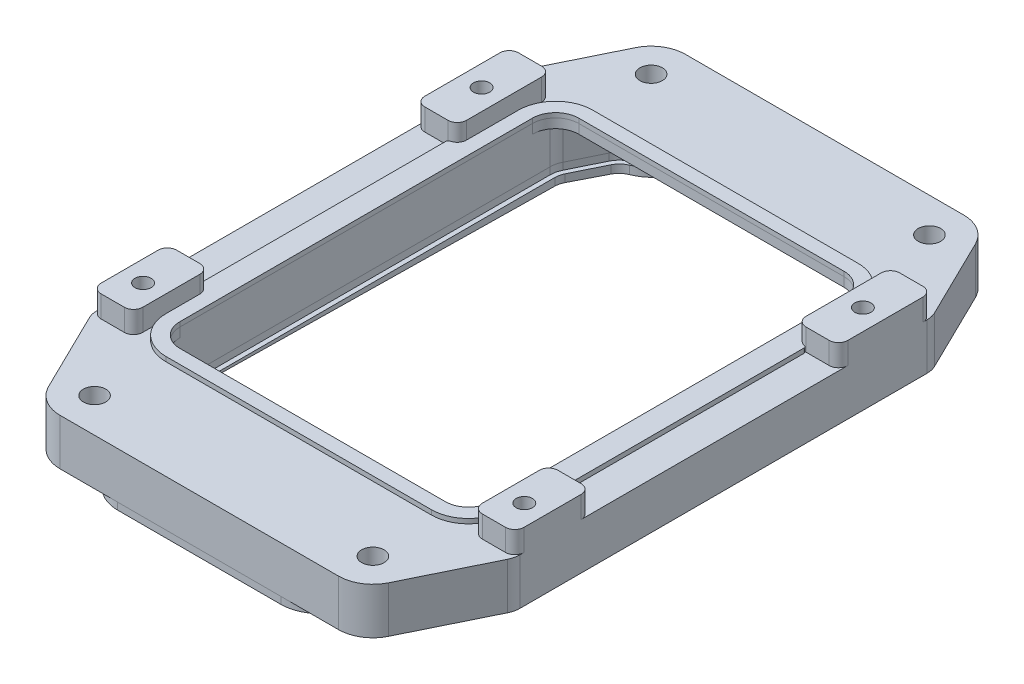
from build123d import *

# Parameters (mm, degrees)
SKETCH1_W               = 9
SKETCH1_H               = 20.2
SKETCH1_R               = 1.75
BOSS_EXTRUDE1_DEPTH     = 4.7
BOSS_EXTRUDE1_2_DEPTH   = 4.7
SKETCH1_H_2             = 16.3
BOSS_EXTRUDE1_3_DEPTH   = 4.7
BOSS_EXTRUDE1_4_DEPTH   = 4.7
BOSS_EXTRUDE2_START     = -10
SKETCH1_3_W             = 91.2
SKETCH1_3_H             = 90
SKETCH1_3_R             = 1.75
BOSS_EXTRUDE2_DEPTH     = 10
SKETCH2_W               = 67.2
SKETCH2_H               = 86
CUT_EXTRUDE1_DEPTH      = 67.20923274
SKETCH3_R               = 2.413
BOSS_EXTRUDE3_DEPTH     = 10
CUT_EXTRUDE2_DEPTH      = 8
FILLET1_R               = 2
FILLET2_R               = 5
FILLET3_R               = 5
FILLET4_R               = 5
BOSS_EXTRUDE4_DEPTH     = 1
FILLET5_R               = 0.5
BOSS_EXTRUDE5_DEPTH     = 3.5
BOSS_EXTRUDE6_START     = 3.5
BOSS_EXTRUDE6_DEPTH     = 2
SKETCH7_R               = 2.65
CUT_EXTRUDE3_DEPTH      = 4.5
CUT_EXTRUDE7_START      = -3
CUT_EXTRUDE7_DEPTH      = 4
CUT_EXTRUDE7_START_2    = -4
CUT_EXTRUDE7_2_DEPTH    = 4
CUT_EXTRUDE7_3_DEPTH    = 3
CUT_EXTRUDE7_4_DEPTH    = 1
BOSS_EXTRUDE8_DEPTH     = 1
BOSS_EXTRUDE9_START     = -3
BOSS_EXTRUDE9_DEPTH     = 4
CUT_EXTRUDE8_DEPTH      = 85.100153204
CUT_EXTRUDE8_DEPTH_BACK = 85.100153204


with BuildPart() as part:
    # Sketch1 → Boss-Extrude1 (new body)
    with BuildSketch(Plane(origin=(0, 0, 0), x_dir=(1, 0, 0), z_dir=(0, 1, 0))):
        with Locations((-41.1, 36.85)):
            Rectangle(SKETCH1_W, SKETCH1_H)
        with Locations(Location((-41.1, 36.5, 0), (0, 0, 270))):
            Circle(SKETCH1_R, mode=Mode.SUBTRACT)
    extrude(amount=BOSS_EXTRUDE1_DEPTH)



with BuildPart() as body_2:
    # Sketch1 → Boss-Extrude1 2 (new body)
    with BuildSketch(Plane(origin=(0, 0, 0), x_dir=(1, 0, 0), z_dir=(0, 1, 0))):
        with Locations((41.1, 36.85)):
            Rectangle(SKETCH1_W, SKETCH1_H)
        with Locations(Location((41.1, 36.5, 0), (0, 0, 270))):
            Circle(SKETCH1_R, mode=Mode.SUBTRACT)
    extrude(amount=BOSS_EXTRUDE1_2_DEPTH)


with BuildPart() as body_3:
    # Sketch1 → Boss-Extrude1 3 (new body)
    with BuildSketch(Plane(origin=(0, 0, 0), x_dir=(1, 0, 0), z_dir=(0, 1, 0))):
        with Locations((41.1, -34.9)):
            Rectangle(SKETCH1_W, SKETCH1_H_2)
        with Locations(Location((41.1, -36.5, 0), (0, 0, 270))):
            Circle(SKETCH1_R, mode=Mode.SUBTRACT)
    extrude(amount=BOSS_EXTRUDE1_3_DEPTH)


with BuildPart() as body_4:
    # Sketch1 → Boss-Extrude1 4 (new body)
    with BuildSketch(Plane(origin=(0, 0, 0), x_dir=(1, 0, 0), z_dir=(0, 1, 0))):
        with Locations((-41.1, -34.9)):
            Rectangle(SKETCH1_W, SKETCH1_H_2)
        with Locations(Location((-41.1, -36.5, 0), (0, 0, 270))):
            Circle(SKETCH1_R, mode=Mode.SUBTRACT)
    extrude(amount=BOSS_EXTRUDE1_4_DEPTH)


with BuildPart() as part_1:
    add(part.part)

    add(body_2.part)  # Boss-Extrude2 merges body 2

    add(body_3.part)  # Boss-Extrude2 merges body 3

    add(body_4.part)  # Boss-Extrude2 merges body 4
    # Sketch1<3> → Boss-Extrude2 (add)
    with BuildSketch(Plane(origin=(0, 0, 0), x_dir=(1, 0, 0), z_dir=(0, 1, 0)).offset(BOSS_EXTRUDE2_START)):
        with Locations((0, 1.95)):
            Rectangle(SKETCH1_3_W, SKETCH1_3_H)
        with Locations(Location((-41.1, 36.5, 0), (0, 0, 270))):
            Circle(SKETCH1_3_R, mode=Mode.SUBTRACT)
        with Locations(Location((41.1, 36.5, 0), (0, 0, 270))):
            Circle(SKETCH1_3_R, mode=Mode.SUBTRACT)
        with Locations(Location((-41.1, -36.5, 0), (0, 0, 270))):
            Circle(SKETCH1_3_R, mode=Mode.SUBTRACT)
        with Locations(Location((41.1, -36.5, 0), (0, 0, 270))):
            Circle(SKETCH1_3_R, mode=Mode.SUBTRACT)
    extrude(amount=BOSS_EXTRUDE2_DEPTH)

    # Sketch2 → Cut-Extrude1 (cut, through all)
    with BuildSketch(Plane(origin=(0, 0, 0), x_dir=(1, 0, 0), z_dir=(0, 1, 0))):
        with Locations((0, 1.95)):
            Rectangle(SKETCH2_W, SKETCH2_H)
    extrude(amount=-CUT_EXTRUDE1_DEPTH, mode=Mode.SUBTRACT)

    # Sketch3 → Boss-Extrude3 (add)
    # profile 1 of 2: a face of its own
    with BuildSketch(Plane.XZ.offset(10)):
        with BuildLine():
            Line((30, 65.463), (-30, 65.463))
            ThreePointArc((-30, 65.463), (-33.923245888, 64.339730574), (-36.657536656, 61.310333522))
            Line((-36.657536656, 61.310333522), (-45.6, 43.05))
            Line((-45.6, 43.05), (45.6, 43.05))
            Line((45.6, 43.05), (36.657536656, 61.310333522))
            ThreePointArc((36.657536656, 61.310333522), (33.923245888, 64.339730574), (30, 65.463))
        make_face()
        with Locations(Location((-30, 58.05, 0), (0, 0, 270))):
            Circle(SKETCH3_R, mode=Mode.SUBTRACT)
        with Locations(Location((30, 58.05, 0), (0, 0, 270))):
            Circle(SKETCH3_R, mode=Mode.SUBTRACT)
    # profile 2 of 2: a face of its own
    with BuildSketch(Plane.XZ.offset(10)):
        with BuildLine():
            Line((45.6, -46.95), (-45.6, -46.95))
            Line((-45.6, -46.95), (-36.657536656, -65.210333522))
            ThreePointArc((-36.657536656, -65.210333522), (-33.923245888, -68.239730574), (-30, -69.363))
            Line((-30, -69.363), (30, -69.363))
            ThreePointArc((30, -69.363), (33.923245888, -68.239730574), (36.657536656, -65.210333522))
            Line((36.657536656, -65.210333522), (45.6, -46.95))
        make_face()
        with Locations(Location((-30, -61.95, 0), (0, 0, 270))):
            Circle(SKETCH3_R, mode=Mode.SUBTRACT)
        with Locations(Location((30, -61.95, 0), (0, 0, 270))):
            Circle(SKETCH3_R, mode=Mode.SUBTRACT)
    extrude(amount=-BOSS_EXTRUDE3_DEPTH)

    # Sketch4 → Cut-Extrude2 (cut)
    with BuildSketch(Plane.XZ.offset(10)):
        with BuildLine():
            Line((-33.6, 41.05), (-28.862017019, 50.724867664))
            ThreePointArc((-28.862017019, 50.724867664), (-23.142281981, 55.234991551), (-24.043658841, 62.463))
            Line((-24.043658841, 62.463), (24.043658841, 62.463))
            ThreePointArc((24.043658841, 62.463), (23.142281981, 55.234991551), (28.862017019, 50.724867664))
            Line((28.862017019, 50.724867664), (33.6, 41.05))
            Line((33.6, 41.05), (-33.6, 41.05))
        make_face()
        with BuildLine():
            Line((-33.6, -44.95), (-28.862017019, -54.624867664))
            ThreePointArc((-28.862017019, -54.624867664), (-23.142281981, -59.134991551), (-24.043658841, -66.363))
            Line((-24.043658841, -66.363), (24.043658841, -66.363))
            ThreePointArc((24.043658841, -66.363), (23.142281981, -59.134991551), (28.862017019, -54.624867664))
            Line((28.862017019, -54.624867664), (33.6, -44.95))
            Line((33.6, -44.95), (-33.6, -44.95))
        make_face()
    extrude(amount=-CUT_EXTRUDE2_DEPTH, mode=Mode.SUBTRACT)

    # Fillet1
    fillet1_edges = [part_1.edges().sort_by_distance(p)[0] for p in [
        (-45.6, 2.35, 43.05),
        (45.6, 2.35, 43.05),
        (-36.6, 2.35, -26.75),
        (-45.6, 2.35, -26.75),
        (-45.6, 2.35, -46.95),
        (-36.6, 2.35, -46.95),
        (45.6, 2.35, -46.95),
        (45.6, 2.35, -26.75),
        (36.6, 2.35, -46.95),
        (36.6, 2.35, -26.75),
        (45.6, 2.35, 26.75),
        (36.6, 2.35, 26.75),
        (36.6, 2.35, 43.05),
        (-45.6, 2.35, 26.75),
        (-36.6, 2.35, 43.05),
        (-36.6, 2.35, 26.75),
    ]]
    fillet(fillet1_edges, radius=FILLET1_R)

    # Fillet2
    fillet2_edges = [part_1.edges().sort_by_distance(p)[0] for p in [
        (33.6, -1, 41.05),
        (-33.6, -1, 41.05),
        (33.6, -1, -44.95),
        (-33.6, -1, -44.95),
    ]]
    fillet(fillet2_edges, radius=FILLET2_R)

    # Fillet3
    fillet3_edges = [part_1.edges().sort_by_distance(p)[0] for p in [
        (28.862017019, -6, 50.724867664),
        (24.043658841, -6, 62.463),
        (-24.043658841, -6, 62.463),
        (-28.862017019, -6, 50.724867664),
        (-28.862017019, -6, -54.624867664),
        (-24.043658841, -6, -66.363),
        (24.043658841, -6, -66.363),
        (28.862017019, -6, -54.624867664),
        (-33.6, -6, 41.05),
        (-33.6, -6, -44.95),
        (33.6, -6, -44.95),
        (33.6, -6, 41.05),
    ]]
    fillet(fillet3_edges, radius=FILLET3_R)

    # Fillet4
    fillet4_edges = [part_1.edges().sort_by_distance(p)[0] for p in [
        (-45.6, -5, -46.95),
        (45.6, -5, 43.05),
        (-45.6, -5, 43.05),
        (45.6, -5, -46.95),
    ]]
    fillet(fillet4_edges, radius=FILLET4_R)

    # Sketch7 → Cut-Extrude3 (cut)
    with BuildSketch(Plane.XZ.offset(10)):
        with Locations(Location((-41.1, 36.5, 0), (0, 0, 270))):
            Circle(SKETCH7_R)
        with Locations(Location((41.1, 36.5, 0), (0, 0, 270))):
            Circle(SKETCH7_R)
        with Locations(Location((41.1, -36.5, 0), (0, 0, 270))):
            Circle(SKETCH7_R)
        with Locations(Location((-41.1, -36.5, 0), (0, 0, 270))):
            Circle(SKETCH7_R)
    extrude(amount=-CUT_EXTRUDE3_DEPTH, mode=Mode.SUBTRACT)

    # Cut-Extrude7 2 outline → Cut-Extrude7 2 (cut)
    with BuildSketch(Plane.XY.offset(-66.363).offset(CUT_EXTRUDE7_START_2)):
        with BuildLine():
            Line((3.257359313, -10), (11.742640687, -10))
            ThreePointArc((11.742640687, -10), (7.5, -8), (3.257359313, -10))
        make_face()
        with BuildLine():
            Line((-11.742640687, -10), (-3.257359313, -10))
            ThreePointArc((-3.257359313, -10), (-7.5, -8), (-11.742640687, -10))
        make_face()
    extrude(amount=CUT_EXTRUDE7_2_DEPTH, mode=Mode.SUBTRACT)


with BuildPart() as body_2_2:
    # Sketch5 → Boss-Extrude4 (new body)
    with BuildSketch(Plane(origin=(0, 0, 0), x_dir=(1, 0, 0), z_dir=(0, 1, 0))):
        with BuildLine():
            Line((36.6, 28.75), (36.6, 39.95))
            ThreePointArc((36.6, 39.95), (34.256854249, 45.606854249), (28.6, 47.95))
            Line((28.6, 47.95), (-28.6, 47.95))
            ThreePointArc((-28.6, 47.95), (-34.256854249, 45.606854249), (-36.6, 39.95))
            Line((-36.6, 39.95), (-36.6, 28.75))
            ThreePointArc((-36.6, 28.75), (-37.185786438, 27.335786438), (-38.6, 26.75))
            Line((-38.6, 26.75), (-38.6, -26.75))
            ThreePointArc((-38.6, -26.75), (-37.185786438, -27.335786438), (-36.6, -28.75))
            Line((-36.6, -28.75), (-36.6, -36.05))
            ThreePointArc((-36.6, -36.05), (-34.256854249, -41.706854249), (-28.6, -44.05))
            Line((-28.6, -44.05), (28.6, -44.05))
            ThreePointArc((28.6, -44.05), (34.256854249, -41.706854249), (36.6, -36.05))
            Line((36.6, -36.05), (36.6, -28.75))
            ThreePointArc((36.6, -28.75), (37.185786438, -27.335786438), (38.6, -26.75))
            Line((38.6, -26.75), (38.6, 26.75))
            ThreePointArc((38.6, 26.75), (37.185786438, 27.335786438), (36.6, 28.75))
        make_face()
        with BuildLine():
            Line((-28.6, -41.05), (28.6, -41.05))
            ThreePointArc((28.6, -41.05), (32.135533906, -39.585533906), (33.6, -36.05))
            Line((33.6, -36.05), (33.6, 39.95))
            ThreePointArc((33.6, 39.95), (32.135533906, 43.485533906), (28.6, 44.95))
            Line((28.6, 44.95), (-28.6, 44.95))
            ThreePointArc((-28.6, 44.95), (-32.135533906, 43.485533906), (-33.6, 39.95))
            Line((-33.6, 39.95), (-33.6, -36.05))
            ThreePointArc((-33.6, -36.05), (-32.135533906, -39.585533906), (-28.6, -41.05))
        make_face(mode=Mode.SUBTRACT)
    extrude(amount=BOSS_EXTRUDE4_DEPTH)

    # Fillet5
    fillet5_edges = [body_2_2.edges().sort_by_distance(p)[0] for p in [
        (-38.6, 0.5, 26.75),
        (-38.6, 0.5, -26.75),
        (38.6, 0.5, -26.75),
        (38.6, 0.5, 26.75),
    ]]
    fillet(fillet5_edges, radius=FILLET5_R)


with BuildPart() as body_3_2:
    # Sketch6 → Boss-Extrude5 (new body)
    with BuildSketch(Plane.XZ.offset(10)):
        with BuildLine():
            Line((-36.6, 39.891432419), (-36.6, 36.05))
            Line((-36.6, 36.05), (-36.6, -39.95))
            Line((-36.6, -39.95), (-36.6, -43.791432419))
            ThreePointArc((-36.6, -43.791432419), (-36.393514003, -45.597294952), (-35.784715128, -47.309936153))
            Line((-35.784715128, -47.309936153), (-32.52677525, -53.962585035))
            ThreePointArc((-32.52677525, -53.962585035), (-30.795372306, -56.297403967), (-28.344035392, -57.859480447))
            ThreePointArc((-28.344035392, -57.859480447), (-26.39996339, -59.397686264), (-25.591937074, -61.741313059))
            ThreePointArc((-25.591937074, -61.741313059), (-23.122367706, -67.152063157), (-17.600887129, -69.363))
            Line((-17.600887129, -69.363), (17.600887129, -69.363))
            ThreePointArc((17.600887129, -69.363), (23.122367706, -67.152063157), (25.591937074, -61.741313059))
            ThreePointArc((25.591937074, -61.741313059), (26.39996339, -59.397686264), (28.344035392, -57.859480447))
            ThreePointArc((28.344035392, -57.859480447), (30.795372306, -56.297403967), (32.52677525, -53.962585035))
            Line((32.52677525, -53.962585035), (35.784715128, -47.309936153))
            ThreePointArc((35.784715128, -47.309936153), (36.393514003, -45.597294952), (36.6, -43.791432419))
            Line((36.6, -43.791432419), (36.6, -39.95))
            Line((36.6, -39.95), (36.6, 36.05))
            Line((36.6, 36.05), (36.6, 39.891432419))
            ThreePointArc((36.6, 39.891432419), (36.393514003, 41.697294952), (35.784715128, 43.409936153))
            Line((35.784715128, 43.409936153), (32.52677525, 50.062585035))
            ThreePointArc((32.52677525, 50.062585035), (30.795372306, 52.397403967), (28.344035392, 53.959480447))
            ThreePointArc((28.344035392, 53.959480447), (26.39996339, 55.497686264), (25.591937074, 57.841313059))
            ThreePointArc((25.591937074, 57.841313059), (23.122367706, 63.252063157), (17.600887129, 65.463))
            Line((17.600887129, 65.463), (-17.600887129, 65.463))
            ThreePointArc((-17.600887129, 65.463), (-23.122367706, 63.252063157), (-25.591937074, 57.841313059))
            ThreePointArc((-25.591937074, 57.841313059), (-26.39996339, 55.497686264), (-28.344035392, 53.959480447))
            ThreePointArc((-28.344035392, 53.959480447), (-30.795372306, 52.397403967), (-32.52677525, 50.062585035))
            Line((-32.52677525, 50.062585035), (-35.784715128, 43.409936153))
            ThreePointArc((-35.784715128, 43.409936153), (-36.393514003, 41.697294952), (-36.6, 39.891432419))
        make_face()
        with BuildLine():
            Line((-33.6, -39.95), (-33.6, 36.05))
            Line((-33.6, 36.05), (-33.6, 39.891432419))
            ThreePointArc((-33.6, 39.891432419), (-33.470946252, 41.020096502), (-33.090446955, 42.090497253))
            Line((-33.090446955, 42.090497253), (-29.832507077, 48.743146135))
            ThreePointArc((-29.832507077, 48.743146135), (-28.750380237, 50.202407967), (-27.218294665, 51.178705767))
            ThreePointArc((-27.218294665, 51.178705767), (-23.952623751, 53.762598748), (-22.595293344, 57.699445662))
            ThreePointArc((-22.595293344, 57.699445662), (-21.051812489, 61.081164473), (-17.600887129, 62.463))
            Line((-17.600887129, 62.463), (17.600887129, 62.463))
            ThreePointArc((17.600887129, 62.463), (21.051812489, 61.081164473), (22.595293344, 57.699445662))
            ThreePointArc((22.595293344, 57.699445662), (23.952623751, 53.762598748), (27.218294665, 51.178705767))
            ThreePointArc((27.218294665, 51.178705767), (28.750380237, 50.202407967), (29.832507077, 48.743146135))
            Line((29.832507077, 48.743146135), (33.090446955, 42.090497253))
            ThreePointArc((33.090446955, 42.090497253), (33.470946252, 41.020096502), (33.6, 39.891432419))
            Line((33.6, 39.891432419), (33.6, 36.05))
            Line((33.6, 36.05), (33.6, -39.95))
            Line((33.6, -39.95), (33.6, -43.791432419))
            ThreePointArc((33.6, -43.791432419), (33.470946252, -44.920096502), (33.090446955, -45.990497253))
            Line((33.090446955, -45.990497253), (29.832507077, -52.643146135))
            ThreePointArc((29.832507077, -52.643146135), (28.750380237, -54.102407967), (27.218294665, -55.078705767))
            ThreePointArc((27.218294665, -55.078705767), (23.952623751, -57.662598748), (22.595293344, -61.599445662))
            ThreePointArc((22.595293344, -61.599445662), (21.051812489, -64.981164473), (17.600887129, -66.363))
            Line((17.600887129, -66.363), (-17.600887129, -66.363))
            ThreePointArc((-17.600887129, -66.363), (-21.051812489, -64.981164473), (-22.595293344, -61.599445662))
            ThreePointArc((-22.595293344, -61.599445662), (-23.952623751, -57.662598748), (-27.218294665, -55.078705767))
            ThreePointArc((-27.218294665, -55.078705767), (-28.750380237, -54.102407967), (-29.832507077, -52.643146135))
            Line((-29.832507077, -52.643146135), (-33.090446955, -45.990497253))
            ThreePointArc((-33.090446955, -45.990497253), (-33.470946252, -44.920096502), (-33.6, -43.791432419))
            Line((-33.6, -43.791432419), (-33.6, -39.95))
        make_face(mode=Mode.SUBTRACT)
    extrude(amount=BOSS_EXTRUDE5_DEPTH)

    # Sketch6<3> → Boss-Extrude6 (add)
    with BuildSketch(Plane.XZ.offset(10).offset(BOSS_EXTRUDE6_START)):
        with BuildLine():
            ThreePointArc((33.6, 39.891432419), (33.470946252, 41.020096502), (33.090446955, 42.090497253))
            Line((33.090446955, 42.090497253), (29.832507077, 48.743146135))
            ThreePointArc((29.832507077, 48.743146135), (28.750380237, 50.202407967), (27.218294665, 51.178705767))
            ThreePointArc((27.218294665, 51.178705767), (23.952623751, 53.762598748), (22.595293344, 57.699445662))
            ThreePointArc((22.595293344, 57.699445662), (21.051812489, 61.081164473), (17.600887129, 62.463))
            Line((17.600887129, 62.463), (-17.600887129, 62.463))
            ThreePointArc((-17.600887129, 62.463), (-21.051812489, 61.081164473), (-22.595293344, 57.699445662))
            ThreePointArc((-22.595293344, 57.699445662), (-23.952623751, 53.762598748), (-27.218294665, 51.178705767))
            ThreePointArc((-27.218294665, 51.178705767), (-28.750380237, 50.202407967), (-29.832507077, 48.743146135))
            Line((-29.832507077, 48.743146135), (-33.090446955, 42.090497253))
            ThreePointArc((-33.090446955, 42.090497253), (-33.470946252, 41.020096502), (-33.6, 39.891432419))
            Line((-33.6, 39.891432419), (-33.6, -43.791432419))
            ThreePointArc((-33.6, -43.791432419), (-33.470946252, -44.920096502), (-33.090446955, -45.990497253))
            Line((-33.090446955, -45.990497253), (-29.832507077, -52.643146135))
            ThreePointArc((-29.832507077, -52.643146135), (-28.750380237, -54.102407967), (-27.218294665, -55.078705767))
            ThreePointArc((-27.218294665, -55.078705767), (-23.952623751, -57.662598748), (-22.595293344, -61.599445662))
            ThreePointArc((-22.595293344, -61.599445662), (-21.051812489, -64.981164473), (-17.600887129, -66.363))
            Line((-17.600887129, -66.363), (17.600887129, -66.363))
            ThreePointArc((17.600887129, -66.363), (21.051812489, -64.981164473), (22.595293344, -61.599445662))
            ThreePointArc((22.595293344, -61.599445662), (23.952623751, -57.662598748), (27.218294665, -55.078705767))
            ThreePointArc((27.218294665, -55.078705767), (28.750380237, -54.102407967), (29.832507077, -52.643146135))
            Line((29.832507077, -52.643146135), (33.090446955, -45.990497253))
            ThreePointArc((33.090446955, -45.990497253), (33.470946252, -44.920096502), (33.6, -43.791432419))
            Line((33.6, -43.791432419), (33.6, 39.891432419))
        make_face()
        with BuildLine():
            ThreePointArc((-32.6, 39.891432419), (-32.496757001, 40.794363686), (-32.192357564, 41.650684286))
            Line((-32.192357564, 41.650684286), (-28.934417686, 48.303333169))
            ThreePointArc((-28.934417686, 48.303333169), (-28.068716214, 49.470742634), (-26.843047757, 50.251780874))
            ThreePointArc((-26.843047757, 50.251780874), (-23.136843871, 53.184236242), (-21.596412101, 57.652156529))
            ThreePointArc((-21.596412101, 57.652156529), (-20.361627417, 60.357531578), (-17.600887129, 61.463))
            Line((-17.600887129, 61.463), (17.600887129, 61.463))
            ThreePointArc((17.600887129, 61.463), (20.361627417, 60.357531578), (21.596412101, 57.652156529))
            ThreePointArc((21.596412101, 57.652156529), (23.136843871, 53.184236242), (26.843047757, 50.251780874))
            ThreePointArc((26.843047757, 50.251780874), (28.068716214, 49.470742634), (28.934417686, 48.303333169))
            Line((28.934417686, 48.303333169), (32.192357564, 41.650684286))
            ThreePointArc((32.192357564, 41.650684286), (32.496757001, 40.794363686), (32.6, 39.891432419))
            Line((32.6, 39.891432419), (32.6, -43.791432419))
            ThreePointArc((32.6, -43.791432419), (32.496757001, -44.694363686), (32.192357564, -45.550684286))
            Line((32.192357564, -45.550684286), (28.934417686, -52.203333169))
            ThreePointArc((28.934417686, -52.203333169), (28.068716214, -53.370742634), (26.843047757, -54.151780874))
            ThreePointArc((26.843047757, -54.151780874), (23.136843871, -57.084236242), (21.596412101, -61.552156529))
            ThreePointArc((21.596412101, -61.552156529), (20.361627417, -64.257531578), (17.600887129, -65.363))
            Line((17.600887129, -65.363), (-17.600887129, -65.363))
            ThreePointArc((-17.600887129, -65.363), (-20.361627417, -64.257531578), (-21.596412101, -61.552156529))
            ThreePointArc((-21.596412101, -61.552156529), (-23.136843871, -57.084236242), (-26.843047757, -54.151780874))
            ThreePointArc((-26.843047757, -54.151780874), (-28.068716214, -53.370742634), (-28.934417686, -52.203333169))
            Line((-28.934417686, -52.203333169), (-32.192357564, -45.550684286))
            ThreePointArc((-32.192357564, -45.550684286), (-32.496757001, -44.694363686), (-32.6, -43.791432419))
            Line((-32.6, -43.791432419), (-32.6, 39.891432419))
        make_face(mode=Mode.SUBTRACT)
    extrude(amount=-BOSS_EXTRUDE6_DEPTH)

    # Cut-Extrude7: read off the stored shape, not the designer's step
    # Cut-Extrude7 outline → Cut-Extrude7 (cut)
    with BuildSketch(Plane.XY.offset(-66.363).offset(CUT_EXTRUDE7_START)):
        with BuildLine():
            Line((-13, -13.5), (13, -13.5))
            ThreePointArc((13, -13.5), (12.676124215, -11.640500575), (11.742640687, -10))
            Line((11.742640687, -10), (-11.742640687, -10))
            ThreePointArc((-11.742640687, -10), (-12.676124215, -11.640500575), (-13, -13.5))
        make_face()
    extrude(amount=CUT_EXTRUDE7_DEPTH, mode=Mode.SUBTRACT)

    # Boss-Extrude8: read off the stored shape, not the designer's step
    # Boss-Extrude8 outline → Boss-Extrude8 (add)
    with BuildSketch(Plane.XY.offset(-66.363)):
        with BuildLine():
            ThreePointArc((2.376524617, -11.5), (7.5, -7.999999999), (12.623475383, -11.5))
            Line((12.623475383, -11.5), (14.728416147, -11.5))
            ThreePointArc((14.728416147, -11.5), (7.5, -6), (0.271583853, -11.5))
            Line((0.271583853, -11.5), (2.376524617, -11.5))
        make_face()
        with BuildLine():
            Line((-2.376524617, -11.5), (-0.271583853, -11.5))
            ThreePointArc((-0.271583853, -11.5), (-7.5, -6), (-14.728416147, -11.5))
            Line((-14.728416147, -11.5), (-12.623475383, -11.5))
            ThreePointArc((-12.623475383, -11.5), (-7.5, -7.999999999), (-2.376524617, -11.5))
        make_face()
    extrude(amount=BOSS_EXTRUDE8_DEPTH)



with BuildPart() as body_4_2:
    # Cut-Extrude7 3 outline → Cut-Extrude7 3 (new body)
    with BuildSketch(Plane.XY.offset(-66.363).offset(CUT_EXTRUDE7_START)):
        with BuildLine():
            Line((3.257359313, -10), (-3.257359313, -10))
            ThreePointArc((-3.257359313, -10), (-2.323875785, -11.640500575), (-2, -13.5))
            Line((-2, -13.5), (2, -13.5))
            ThreePointArc((2, -13.5), (2.323875785, -11.640500575), (3.257359313, -10))
        make_face()
    extrude(amount=CUT_EXTRUDE7_3_DEPTH)

    # Cut-Extrude7 4 outline → Cut-Extrude7 4 (add)
    with BuildSketch(Plane.XY.offset(-66.363)):
        with BuildLine():
            Line((2.376524617, -11.5), (-2.376524617, -11.5))
            ThreePointArc((-2.376524617, -11.5), (-2.094950758, -12.482432952), (-2, -13.5))
            Line((-2, -13.5), (2, -13.5))
            ThreePointArc((2, -13.5), (2.094950758, -12.482432952), (2.376524617, -11.5))
        make_face()
    extrude(amount=CUT_EXTRUDE7_4_DEPTH)


with BuildPart() as body_3_2_1:
    add(body_3_2.part)

    add(body_4_2.part)  # Boss-Extrude9 merges body 4 2
    # Sketch13<4> → Boss-Extrude9 (add)
    with BuildSketch(Plane.XY.offset(-66.363).offset(BOSS_EXTRUDE9_START)):
        with BuildLine():
            Line((-4.671572875, -10), (-3.257359313, -10))
            ThreePointArc((-3.257359313, -10), (-7.5, -8), (-11.742640687, -10))
            Line((-11.742640687, -10), (-10.328427125, -10))
            ThreePointArc((-10.328427125, -10), (-7.5, -9), (-4.671572875, -10))
        make_face()
        with BuildLine():
            Line((-10.328427125, -10), (-11.742640687, -10))
            ThreePointArc((-11.742640687, -10), (-12.242734713, -10.714956474), (-12.623475383, -11.5))
            ThreePointArc((-12.623475383, -11.5), (-12.905049242, -12.482432952), (-13, -13.5))
            Line((-13, -13.5), (-12, -13.5))
            ThreePointArc((-12, -13.5), (-11.560660172, -11.560660172), (-10.328427125, -10))
        make_face()
        with BuildLine():
            ThreePointArc((-2.376524617, -11.5), (-2.757265287, -10.714956474), (-3.257359313, -10))
            Line((-3.257359313, -10), (-4.671572875, -10))
            ThreePointArc((-4.671572875, -10), (-3.439339828, -11.560660172), (-3, -13.5))
            Line((-3, -13.5), (-2, -13.5))
            ThreePointArc((-2, -13.5), (-2.094950758, -12.482432952), (-2.376524617, -11.5))
        make_face()
        with BuildLine():
            Line((10.328427125, -10), (11.742640687, -10))
            ThreePointArc((11.742640687, -10), (7.5, -8), (3.257359313, -10))
            Line((3.257359313, -10), (4.671572875, -10))
            ThreePointArc((4.671572875, -10), (7.5, -9), (10.328427125, -10))
        make_face()
        with BuildLine():
            Line((4.671572875, -10), (3.257359313, -10))
            ThreePointArc((3.257359313, -10), (2.757265287, -10.714956474), (2.376524617, -11.5))
            ThreePointArc((2.376524617, -11.5), (2.094950758, -12.482432952), (2, -13.5))
            Line((2, -13.5), (3, -13.5))
            ThreePointArc((3, -13.5), (3.439339828, -11.560660172), (4.671572875, -10))
        make_face()
        with BuildLine():
            ThreePointArc((13, -13.5), (12.905049242, -12.482432952), (12.623475383, -11.5))
            ThreePointArc((12.623475383, -11.5), (12.242734713, -10.714956474), (11.742640687, -10))
            Line((11.742640687, -10), (10.328427125, -10))
            ThreePointArc((10.328427125, -10), (11.560660172, -11.560660172), (12, -13.5))
            Line((12, -13.5), (13, -13.5))
        make_face()
    extrude(amount=BOSS_EXTRUDE9_DEPTH)

    # Sketch14 → Cut-Extrude8 (cut, two sides: drawn at the far end of the back side and taken through both)
    with BuildSketch(Plane(origin=(0, 0, 0), x_dir=(0, 0, -1), z_dir=(1, 0, 0)).offset(-CUT_EXTRUDE8_DEPTH_BACK)):
        Polygon((-65.463, -11.5), (69.363, -13.5), (81.320365254, -23.831094186), (-75.457140672, -19.063263058), align=None)
    extrude(amount=CUT_EXTRUDE8_DEPTH + CUT_EXTRUDE8_DEPTH_BACK, mode=Mode.SUBTRACT)


solid = Compound([part_1.part, body_2_2.part, body_3_2_1.part])
